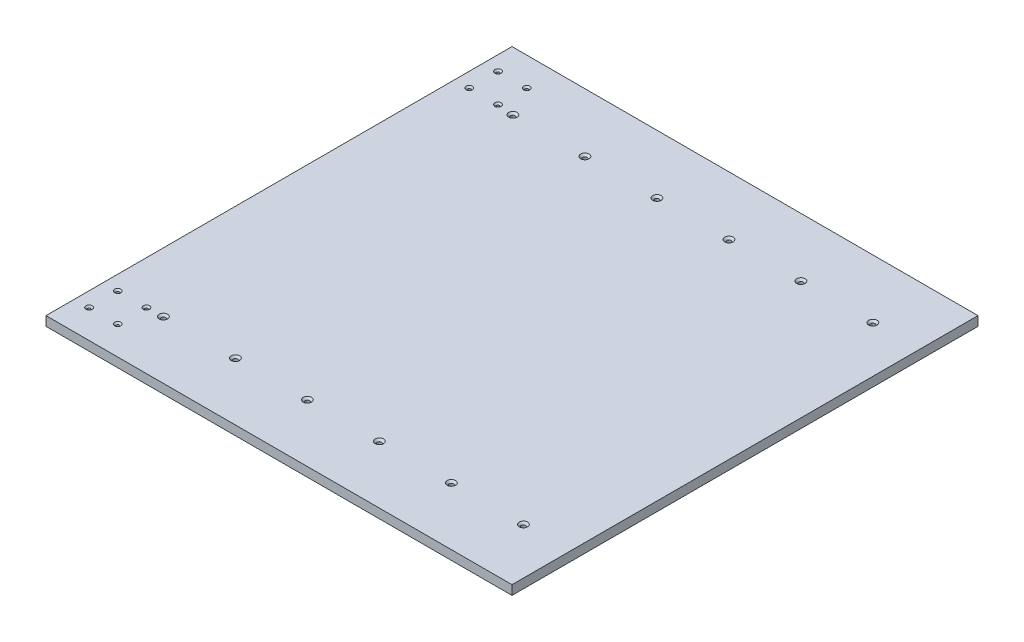
from build123d import *

# Parameters (mm, degrees)
SZKIC1_W                                             = 500
SZKIC1_H                                             = 500
DODANIE_WYCI_GNI_CIE1_DEPTH                          = 10
POG_BIENIE_STO_KOWE_POD_M3_WKR_T_USTALAJ_D           = 3.4
POG_BIENIE_STO_KOWE_POD_M3_WKR_T_USTALAJ_DEPTH       = 10
POG_BIENIE_STO_KOWE_POD_M3_WKR_T_USTALAJ_CSINK_D     = 6.72
POG_BIENIE_STO_KOWE_POD_M3_WKR_T_USTALAJ_CSINK_ANGLE = 90
POG_BIENIE_STO_KOWE_POD_M3_WKR_T_USTALAJ_TIP         = 1.021463052
POG_BIENIE_STO_KOWE_POD_M4_WKR_T_USTALAJ_D           = 4.8
POG_BIENIE_STO_KOWE_POD_M4_WKR_T_USTALAJ_DEPTH       = 11.5
POG_BIENIE_STO_KOWE_POD_M4_WKR_T_USTALAJ_CSINK_D     = 8.96
POG_BIENIE_STO_KOWE_POD_M4_WKR_T_USTALAJ_CSINK_ANGLE = 90
POG_BIENIE_STO_KOWE_POD_M4_WKR_T_USTALAJ_TIP         = 1.442065486
SZKIC8_W                                             = 400
SZKIC8_H                                             = 10
WYTNIJ_WYCI_GNI_CIE1_DEPTH                           = 1
ZAOKR_GLENIE1_R                                      = 2


with BuildPart() as part:
    # Szkic1 → Dodanie-wyciągnięcie1 (new body)
    with BuildSketch(Plane(origin=(0, 0, 0), x_dir=(1, 0, 0), z_dir=(0, 1, 0))):
        with Locations((250, 250)):
            Rectangle(SZKIC1_W, SZKIC1_H)
    extrude(amount=DODANIE_WYCI_GNI_CIE1_DEPTH)

    # Pogłębienie stożkowe pod M3 Wkręt ustalający1
    with Locations(Plane(origin=(0, 10, 0), x_dir=(1, 0, 0), z_dir=(0, 1, 0))):
        with Locations((46.4, 30.6), (46.4, 61.4), (15.6, 61.4), (15.6, 30.6), (46.4, 438.6), (46.4, 469.4), (15.6, 469.4), (15.6, 438.6)):
            CounterSinkHole(POG_BIENIE_STO_KOWE_POD_M3_WKR_T_USTALAJ_D / 2, POG_BIENIE_STO_KOWE_POD_M3_WKR_T_USTALAJ_CSINK_D / 2, depth=POG_BIENIE_STO_KOWE_POD_M3_WKR_T_USTALAJ_DEPTH, counter_sink_angle=POG_BIENIE_STO_KOWE_POD_M3_WKR_T_USTALAJ_CSINK_ANGLE)
            with Locations((0, 0, -(POG_BIENIE_STO_KOWE_POD_M3_WKR_T_USTALAJ_DEPTH + POG_BIENIE_STO_KOWE_POD_M3_WKR_T_USTALAJ_TIP / 2))):  # 118° drill point
                Cone(0, POG_BIENIE_STO_KOWE_POD_M3_WKR_T_USTALAJ_D / 2, POG_BIENIE_STO_KOWE_POD_M3_WKR_T_USTALAJ_TIP, mode=Mode.SUBTRACT)

    # Pogłębienie stożkowe pod M4 Wkręt ustalający1
    with Locations(Plane(origin=(0, 10, 0), x_dir=(1, 0, 0), z_dir=(0, 1, 0))):
        with Locations((63.9, 62.07), (141.15, 62.07), (218.4, 62.07), (295.65, 62.07), (372.9, 62.07), (450.15, 62.07), (141.15, 437.07), (218.4, 437.07), (295.65, 437.07), (372.9, 437.07), (450.15, 437.07), (63.9, 437.07)):
            CounterSinkHole(POG_BIENIE_STO_KOWE_POD_M4_WKR_T_USTALAJ_D / 2, POG_BIENIE_STO_KOWE_POD_M4_WKR_T_USTALAJ_CSINK_D / 2, depth=POG_BIENIE_STO_KOWE_POD_M4_WKR_T_USTALAJ_DEPTH, counter_sink_angle=POG_BIENIE_STO_KOWE_POD_M4_WKR_T_USTALAJ_CSINK_ANGLE)
            with Locations((0, 0, -(POG_BIENIE_STO_KOWE_POD_M4_WKR_T_USTALAJ_DEPTH + POG_BIENIE_STO_KOWE_POD_M4_WKR_T_USTALAJ_TIP / 2))):  # 118° drill point
                Cone(0, POG_BIENIE_STO_KOWE_POD_M4_WKR_T_USTALAJ_D / 2, POG_BIENIE_STO_KOWE_POD_M4_WKR_T_USTALAJ_TIP, mode=Mode.SUBTRACT)

    # Szkic8 → Wytnij-wyciągnięcie1 (cut)
    with BuildSketch(Plane.XZ):
        with Locations((260, -42)):
            Rectangle(SZKIC8_W, SZKIC8_H)
        with Locations((260, -82)):
            Rectangle(SZKIC8_W, SZKIC8_H)
        with Locations((260, -457)):
            Rectangle(SZKIC8_W, SZKIC8_H)
        with Locations((260, -417)):
            Rectangle(SZKIC8_W, SZKIC8_H)
    extrude(amount=-WYTNIJ_WYCI_GNI_CIE1_DEPTH, mode=Mode.SUBTRACT)

    # Zaokrąglenie1
    # the kernel refuses this fillet: 2 mm, written as the material it adds along each edge
    with BuildSketch(Plane(origin=(460, 1, -466.330127019), x_dir=(0, -1, 0), z_dir=(0, 0, 1)), Plane(origin=(60, 1, -447.669872981), x_dir=(0, -1, 0), z_dir=(0, 0, -1)), Plane(origin=(460, 1, -426.330127019), x_dir=(0, -1, 0), z_dir=(0, 0, 1)), Plane(origin=(60, 1, -407.669872981), x_dir=(0, -1, 0), z_dir=(0, 0, -1)), Plane(origin=(460, 1, -91.330127019), x_dir=(0, -1, 0), z_dir=(0, 0, 1)), Plane(origin=(60, 1, -72.669872981), x_dir=(0, -1, 0), z_dir=(0, 0, -1))) as zaokr_glenie1_piece_1:
        with BuildLine():
            CenterArc((2, -1.732050808), ZAOKR_GLENIE1_R, 120, 60)
            Line((0, -1.732050808), (-0.04, -1.732050808))
            Line((-0.04, -1.732050808), (-0.04, 0))
            Line((-0.04, 0), (0, 0.04))
            ThreePointArc((0, 0.04), (0.5, 0.04), (0.98, 0.034641016))
            Line((0.98, 0.034641016), (1, 0))
        make_face()
    extrude(amount=18.660254038)
    with BuildSketch(Plane(origin=(55.669872981, 1, -462), x_dir=(0, -1, 0), z_dir=(1, 0, 0)), Plane(origin=(464.330127019, 1, -452), x_dir=(0, -1, 0), z_dir=(-1, 0, 0)), Plane(origin=(55.669872981, 1, -422), x_dir=(0, -1, 0), z_dir=(1, 0, 0)), Plane(origin=(464.330127019, 1, -412), x_dir=(0, -1, 0), z_dir=(-1, 0, 0)), Plane(origin=(55.669872981, 1, -87), x_dir=(0, -1, 0), z_dir=(1, 0, 0)), Plane(origin=(464.330127019, 1, -77), x_dir=(0, -1, 0), z_dir=(-1, 0, 0))) as zaokr_glenie1_piece_2:
        with BuildLine():
            CenterArc((2, -1.732050808), ZAOKR_GLENIE1_R, 120, 60)
            Line((0, -1.732050808), (-0.04, -1.732050808))
            Line((-0.04, -1.732050808), (-0.04, 0))
            Line((-0.04, 0), (0, 0.04))
            ThreePointArc((0, 0.04), (0.5, 0.04), (0.98, 0.034641016))
            Line((0.98, 0.034641016), (1, 0))
        make_face()
    extrude(amount=408.660254038)
    with BuildSketch(Plane(origin=(55.669872981, 1, -37), x_dir=(0, -1, 0), z_dir=(1, 0, 0)), Plane(origin=(464.330127019, 1, -47), x_dir=(0, -1, 0), z_dir=(-1, 0, 0))) as zaokr_glenie1_piece_3:
        with BuildLine():
            CenterArc((2, 1.732050808), ZAOKR_GLENIE1_R, 180, 60)
            Line((0, 1.732050808), (-0.04, 1.732050808))
            Line((-0.04, 1.732050808), (-0.04, 0))
            Line((-0.04, 0), (0, -0.04))
            ThreePointArc((0, -0.04), (0.5, -0.04), (0.98, -0.034641016))
            Line((0.98, -0.034641016), (1, 0))
        make_face()
    extrude(amount=408.660254038)
    with BuildSketch(Plane(origin=(460, 1, -32.669872981), x_dir=(0, -1, 0), z_dir=(0, 0, -1)), Plane(origin=(60, 1, -51.330127019), x_dir=(0, -1, 0), z_dir=(0, 0, 1))) as zaokr_glenie1_piece_4:
        with BuildLine():
            CenterArc((2, 1.732050808), ZAOKR_GLENIE1_R, 180, 60)
            Line((0, 1.732050808), (-0.04, 1.732050808))
            Line((-0.04, 1.732050808), (-0.04, 0))
            Line((-0.04, 0), (0, -0.04))
            ThreePointArc((0, -0.04), (0.5, -0.04), (0.98, -0.034641016))
            Line((0.98, -0.034641016), (1, 0))
        make_face()
    extrude(amount=18.660254038)


solid = part.part
